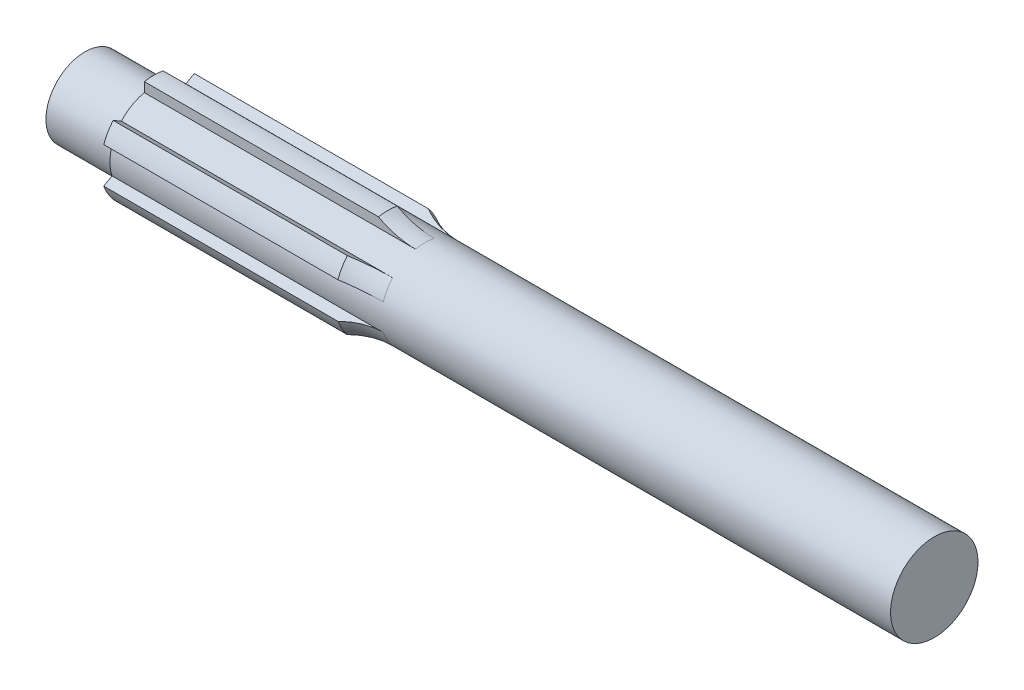
from build123d import *

# Parameters (mm, degrees)
SKETCH1_R           = 12.5
BOSS_EXTRUDE1_DEPTH = 22
SKETCH3_R           = 14
BOSS_EXTRUDE2_DEPTH = 250
BOSS_EXTRUDE3_DEPTH = 75
FILLET3_R           = 25


with BuildPart() as part:
    # Sketch1 → Boss-Extrude1 (new body)
    with BuildSketch(Plane(origin=(0, 0, 0), x_dir=(0, 0, -1), z_dir=(1, 0, 0))):
        Circle(SKETCH1_R)
    extrude(amount=BOSS_EXTRUDE1_DEPTH)

    # Sketch3 → Boss-Extrude2 (add)
    with BuildSketch(Plane(origin=(22, 0, 0), x_dir=(0, 0, -1), z_dir=(1, 0, 0))):
        Circle(SKETCH3_R)
    extrude(amount=BOSS_EXTRUDE2_DEPTH)

    # Sketch2 → Boss-Extrude3 (add)
    with BuildSketch(Plane(origin=(22, 0, 0), x_dir=(0, 0, -1), z_dir=(1, 0, 0))):
        with BuildLine():
            Line((-13.342719282, -4.239320954), (-15.991376746, -5.768524054))
            ThreePointArc((-15.991376746, -5.768524054), (-14.722431864, -8.5), (-12.991376746, -10.964676477))
            Line((-12.991376746, -10.964676477), (-10.342719282, -9.435473377))
            ThreePointArc((-10.342719282, -9.435473377), (-7, -12.124355653), (-3, -13.674794331))
            Line((-3, -13.674794331), (-3, -16.733200531))
            ThreePointArc((-3, -16.733200531), (0, -17), (3, -16.733200531))
            Line((3, -16.733200531), (3, -13.674794331))
            ThreePointArc((3, -13.674794331), (7, -12.124355653), (10.342719282, -9.435473377))
            Line((10.342719282, -9.435473377), (12.991376746, -10.964676477))
            ThreePointArc((12.991376746, -10.964676477), (14.722431864, -8.5), (15.991376746, -5.768524054))
            Line((15.991376746, -5.768524054), (13.342719282, -4.239320954))
            ThreePointArc((13.342719282, -4.239320954), (14, 0), (13.342719282, 4.239320954))
            Line((13.342719282, 4.239320954), (15.991376746, 5.768524054))
            ThreePointArc((15.991376746, 5.768524054), (14.722431864, 8.5), (12.991376746, 10.964676477))
            Line((12.991376746, 10.964676477), (10.342719282, 9.435473377))
            ThreePointArc((10.342719282, 9.435473377), (7, 12.124355653), (3, 13.674794331))
            Line((3, 13.674794331), (3, 16.733200531))
            ThreePointArc((3, 16.733200531), (0, 17), (-3, 16.733200531))
            Line((-3, 16.733200531), (-3, 13.674794331))
            ThreePointArc((-3, 13.674794331), (-7, 12.124355653), (-10.342719282, 9.435473377))
            Line((-10.342719282, 9.435473377), (-12.991376746, 10.964676477))
            ThreePointArc((-12.991376746, 10.964676477), (-14.722431864, 8.5), (-15.991376746, 5.768524054))
            Line((-15.991376746, 5.768524054), (-13.342719282, 4.239320954))
            ThreePointArc((-13.342719282, 4.239320954), (-14, 0), (-13.342719282, -4.239320954))
        make_face()
    extrude(amount=BOSS_EXTRUDE3_DEPTH)

    # Fillet3
    # the kernel refuses this fillet: 25 mm, written as the material it adds along each edge
    with BuildSketch(Plane(origin=(97, 0, 0), x_dir=(0, 0.27784568580579977, 0.960625720496336), z_dir=(0, -0.960625720496336, 0.27784568580579977))) as fillet3_piece_1_section:
        with BuildLine():
            CenterArc((39, -11.874342087), FILLET3_R, 151.642363424, 28.357636576)
            Line((17, 0), (14, 0))
            Line((14, 0), (14, -11.874342087))
        make_face()
    fillet3_piece_1 = revolve(axis=Axis((97, 0, 0), (-1, 0, 0)), revolution_arc=267.736659013, mode=Mode.PRIVATE)
    fillet3_piece_1 = split(fillet3_piece_1, bisect_by=Plane(origin=(97, 2.598076211, -1.5), z_dir=(0, -0.8660254037844357, 0.5000000000000051)), keep=Keep.TOP, mode=Mode.PRIVATE)
    fillet3_piece_1 = split(fillet3_piece_1, bisect_by=Plane(origin=(97, -2.598076211, 1.5), z_dir=(0, 0.8660254037844359, -0.5000000000000047)), keep=Keep.TOP, mode=Mode.PRIVATE)
    add(fillet3_piece_1)
    with BuildSketch(Plane(origin=(97, 0, 0), x_dir=(0, 0.27784568580579977, 0.960625720496336), z_dir=(0, -0.960625720496336, 0.27784568580579977))) as fillet3_piece_2_section:
        with BuildLine():
            CenterArc((39, -11.874342087), FILLET3_R, 151.642363424, 28.357636576)
            Line((17, 0), (14, 0))
            Line((14, 0), (14, -11.874342087))
        make_face()
    fillet3_piece_2 = revolve(axis=Axis((97, 0, 0), (-1, 0, 0)), revolution_arc=267.736659013, mode=Mode.PRIVATE)
    fillet3_piece_2 = split(fillet3_piece_2, bisect_by=Plane(origin=(97, 0, -3), z_dir=(0, 0, 1)), keep=Keep.TOP, mode=Mode.PRIVATE)
    fillet3_piece_2 = split(fillet3_piece_2, bisect_by=Plane(origin=(97, 0, 3), z_dir=(0, 0, -1)), keep=Keep.TOP, mode=Mode.PRIVATE)
    add(fillet3_piece_2)
    with BuildSketch(Plane(origin=(97, 0, 0), x_dir=(0, 0.27784568580579977, 0.960625720496336), z_dir=(0, -0.960625720496336, 0.27784568580579977))) as fillet3_piece_3_section:
        with BuildLine():
            CenterArc((39, -11.874342087), FILLET3_R, 151.642363424, 28.357636576)
            Line((17, 0), (14, 0))
            Line((14, 0), (14, -11.874342087))
        make_face()
    fillet3_piece_3 = revolve(axis=Axis((97, 0, 0), (-1, 0, 0)), revolution_arc=267.736659013, mode=Mode.PRIVATE)
    fillet3_piece_3 = split(fillet3_piece_3, bisect_by=Plane(origin=(97, -2.598076211, -1.5), z_dir=(0, 0.8660254037844438, 0.4999999999999911)), keep=Keep.TOP, mode=Mode.PRIVATE)
    fillet3_piece_3 = split(fillet3_piece_3, bisect_by=Plane(origin=(97, 2.598076211, 1.5), z_dir=(0, -0.8660254037844435, -0.49999999999999156)), keep=Keep.TOP, mode=Mode.PRIVATE)
    add(fillet3_piece_3)
    with BuildSketch(Plane(origin=(97, 0, 0), x_dir=(0, 0.9708491203814568, 0.23969143800843562), z_dir=(0, -0.23969143800843562, 0.9708491203814568))) as fillet3_piece_4_section:
        with BuildLine():
            CenterArc((39, -11.874342087), FILLET3_R, 151.642363424, 28.357636576)
            Line((17, 0), (14, 0))
            Line((14, 0), (14, -11.874342087))
        make_face()
    fillet3_piece_4 = revolve(axis=Axis((97, 0, 0), (-1, 0, 0)), revolution_arc=267.736659013, mode=Mode.PRIVATE)
    fillet3_piece_4 = split(fillet3_piece_4, bisect_by=Plane(origin=(97, 0, -3), z_dir=(0, 0, 1)), keep=Keep.TOP, mode=Mode.PRIVATE)
    fillet3_piece_4 = split(fillet3_piece_4, bisect_by=Plane(origin=(97, 0, 3), z_dir=(0, 0, -1)), keep=Keep.TOP, mode=Mode.PRIVATE)
    add(fillet3_piece_4)
    with BuildSketch(Plane(origin=(97, 0, 0), x_dir=(0, 0.9708491203814568, 0.23969143800843562), z_dir=(0, -0.23969143800843562, 0.9708491203814568))) as fillet3_piece_5_section:
        with BuildLine():
            CenterArc((39, -11.874342087), FILLET3_R, 151.642363424, 28.357636576)
            Line((17, 0), (14, 0))
            Line((14, 0), (14, -11.874342087))
        make_face()
    fillet3_piece_5 = revolve(axis=Axis((97, 0, 0), (-1, 0, 0)), revolution_arc=267.736659013, mode=Mode.PRIVATE)
    fillet3_piece_5 = split(fillet3_piece_5, bisect_by=Plane(origin=(97, -2.598076211, -1.5), z_dir=(0, 0.8660254037844438, 0.4999999999999911)), keep=Keep.TOP, mode=Mode.PRIVATE)
    fillet3_piece_5 = split(fillet3_piece_5, bisect_by=Plane(origin=(97, 2.598076211, 1.5), z_dir=(0, -0.8660254037844435, -0.49999999999999156)), keep=Keep.TOP, mode=Mode.PRIVATE)
    add(fillet3_piece_5)
    with BuildSketch(Plane(origin=(97, 0, 0), x_dir=(0, 0.9708491203814568, 0.23969143800843562), z_dir=(0, -0.23969143800843562, 0.9708491203814568))) as fillet3_piece_6_section:
        with BuildLine():
            CenterArc((39, -11.874342087), FILLET3_R, 151.642363424, 28.357636576)
            Line((17, 0), (14, 0))
            Line((14, 0), (14, -11.874342087))
        make_face()
    fillet3_piece_6 = revolve(axis=Axis((97, 0, 0), (-1, 0, 0)), revolution_arc=267.736659013, mode=Mode.PRIVATE)
    fillet3_piece_6 = split(fillet3_piece_6, bisect_by=Plane(origin=(97, -2.598076211, 1.5), z_dir=(0, 0.8660254037844325, -0.5000000000000107)), keep=Keep.TOP, mode=Mode.PRIVATE)
    fillet3_piece_6 = split(fillet3_piece_6, bisect_by=Plane(origin=(97, 2.598076211, -1.5), z_dir=(0, -0.8660254037844329, 0.5000000000000101)), keep=Keep.TOP, mode=Mode.PRIVATE)
    add(fillet3_piece_6)
    with BuildSketch(Plane(origin=(97, 0, 0), x_dir=(0, 0.6930034345756666, -0.7209342824878907), z_dir=(0, 0.7209342824878907, 0.6930034345756666))) as fillet3_piece_7_section:
        with BuildLine():
            CenterArc((39, -11.874342087), FILLET3_R, 151.642363424, 28.357636576)
            Line((17, 0), (14, 0))
            Line((14, 0), (14, -11.874342087))
        make_face()
    fillet3_piece_7 = revolve(axis=Axis((97, 0, 0), (-1, 0, 0)), revolution_arc=267.736659013, mode=Mode.PRIVATE)
    fillet3_piece_7 = split(fillet3_piece_7, bisect_by=Plane(origin=(97, -2.598076211, -1.5), z_dir=(0, 0.8660254037844438, 0.4999999999999911)), keep=Keep.TOP, mode=Mode.PRIVATE)
    fillet3_piece_7 = split(fillet3_piece_7, bisect_by=Plane(origin=(97, 2.598076211, 1.5), z_dir=(0, -0.8660254037844435, -0.49999999999999156)), keep=Keep.TOP, mode=Mode.PRIVATE)
    add(fillet3_piece_7)
    with BuildSketch(Plane(origin=(97, 0, 0), x_dir=(0, 0.6930034345756666, -0.7209342824878907), z_dir=(0, 0.7209342824878907, 0.6930034345756666))) as fillet3_piece_8_section:
        with BuildLine():
            CenterArc((39, -11.874342087), FILLET3_R, 151.642363424, 28.357636576)
            Line((17, 0), (14, 0))
            Line((14, 0), (14, -11.874342087))
        make_face()
    fillet3_piece_8 = revolve(axis=Axis((97, 0, 0), (-1, 0, 0)), revolution_arc=267.736659013, mode=Mode.PRIVATE)
    fillet3_piece_8 = split(fillet3_piece_8, bisect_by=Plane(origin=(97, 2.598076211, -1.5), z_dir=(0, -0.8660254037844357, 0.5000000000000051)), keep=Keep.TOP, mode=Mode.PRIVATE)
    fillet3_piece_8 = split(fillet3_piece_8, bisect_by=Plane(origin=(97, -2.598076211, 1.5), z_dir=(0, 0.8660254037844359, -0.5000000000000047)), keep=Keep.TOP, mode=Mode.PRIVATE)
    add(fillet3_piece_8)
    with BuildSketch(Plane(origin=(97, 0, 0), x_dir=(0, 0.6930034345756666, -0.7209342824878907), z_dir=(0, 0.7209342824878907, 0.6930034345756666))) as fillet3_piece_9_section:
        with BuildLine():
            CenterArc((39, -11.874342087), FILLET3_R, 151.642363424, 28.357636576)
            Line((17, 0), (14, 0))
            Line((14, 0), (14, -11.874342087))
        make_face()
    fillet3_piece_9 = revolve(axis=Axis((97, 0, 0), (-1, 0, 0)), revolution_arc=267.736659013, mode=Mode.PRIVATE)
    fillet3_piece_9 = split(fillet3_piece_9, bisect_by=Plane(origin=(97, 0, 3), z_dir=(0, 0, -1)), keep=Keep.TOP, mode=Mode.PRIVATE)
    fillet3_piece_9 = split(fillet3_piece_9, bisect_by=Plane(origin=(97, 0, -3), z_dir=(0, 0, 1)), keep=Keep.TOP, mode=Mode.PRIVATE)
    add(fillet3_piece_9)
    with BuildSketch(Plane(origin=(97, 0, 0), x_dir=(0, -0.2778456858057889, -0.9606257204963392), z_dir=(0, 0.9606257204963392, -0.2778456858057889))) as fillet3_piece_10_section:
        with BuildLine():
            CenterArc((39, -11.874342087), FILLET3_R, 151.642363424, 28.357636576)
            Line((17, 0), (14, 0))
            Line((14, 0), (14, -11.874342087))
        make_face()
    fillet3_piece_10 = revolve(axis=Axis((97, 0, 0), (-1, 0, 0)), revolution_arc=267.736659013, mode=Mode.PRIVATE)
    fillet3_piece_10 = split(fillet3_piece_10, bisect_by=Plane(origin=(97, 2.598076211, -1.5), z_dir=(0, -0.8660254037844357, 0.5000000000000051)), keep=Keep.TOP, mode=Mode.PRIVATE)
    fillet3_piece_10 = split(fillet3_piece_10, bisect_by=Plane(origin=(97, -2.598076211, 1.5), z_dir=(0, 0.8660254037844359, -0.5000000000000047)), keep=Keep.TOP, mode=Mode.PRIVATE)
    add(fillet3_piece_10)
    with BuildSketch(Plane(origin=(97, 0, 0), x_dir=(0, -0.2778456858057889, -0.9606257204963392), z_dir=(0, 0.9606257204963392, -0.2778456858057889))) as fillet3_piece_11_section:
        with BuildLine():
            CenterArc((39, -11.874342087), FILLET3_R, 151.642363424, 28.357636576)
            Line((17, 0), (14, 0))
            Line((14, 0), (14, -11.874342087))
        make_face()
    fillet3_piece_11 = revolve(axis=Axis((97, 0, 0), (-1, 0, 0)), revolution_arc=267.736659013, mode=Mode.PRIVATE)
    fillet3_piece_11 = split(fillet3_piece_11, bisect_by=Plane(origin=(97, 0, -3), z_dir=(0, 0, 1)), keep=Keep.TOP, mode=Mode.PRIVATE)
    fillet3_piece_11 = split(fillet3_piece_11, bisect_by=Plane(origin=(97, 0, 3), z_dir=(0, 0, -1)), keep=Keep.TOP, mode=Mode.PRIVATE)
    add(fillet3_piece_11)
    with BuildSketch(Plane(origin=(97, 0, 0), x_dir=(0, -0.2778456858057889, -0.9606257204963392), z_dir=(0, 0.9606257204963392, -0.2778456858057889))) as fillet3_piece_12_section:
        with BuildLine():
            CenterArc((39, -11.874342087), FILLET3_R, 151.642363424, 28.357636576)
            Line((17, 0), (14, 0))
            Line((14, 0), (14, -11.874342087))
        make_face()
    fillet3_piece_12 = revolve(axis=Axis((97, 0, 0), (-1, 0, 0)), revolution_arc=267.736659013, mode=Mode.PRIVATE)
    fillet3_piece_12 = split(fillet3_piece_12, bisect_by=Plane(origin=(97, 2.598076211, 1.5), z_dir=(0, -0.86602540378444, -0.4999999999999976)), keep=Keep.TOP, mode=Mode.PRIVATE)
    fillet3_piece_12 = split(fillet3_piece_12, bisect_by=Plane(origin=(97, -2.598076211, -1.5), z_dir=(0, 0.86602540378444, 0.49999999999999767)), keep=Keep.TOP, mode=Mode.PRIVATE)
    add(fillet3_piece_12)
    with BuildSketch(Plane(origin=(97, 0, 0), x_dir=(0, -0.9708491203814544, -0.23969143800844478), z_dir=(0, 0.23969143800844478, -0.9708491203814544))) as fillet3_piece_13_section:
        with BuildLine():
            CenterArc((39, -11.874342087), FILLET3_R, 151.642363424, 28.357636576)
            Line((17, 0), (14, 0))
            Line((14, 0), (14, -11.874342087))
        make_face()
    fillet3_piece_13 = revolve(axis=Axis((97, 0, 0), (-1, 0, 0)), revolution_arc=267.736659013, mode=Mode.PRIVATE)
    fillet3_piece_13 = split(fillet3_piece_13, bisect_by=Plane(origin=(97, 0, -3), z_dir=(0, 0, 1)), keep=Keep.TOP, mode=Mode.PRIVATE)
    fillet3_piece_13 = split(fillet3_piece_13, bisect_by=Plane(origin=(97, 0, 3), z_dir=(0, 0, -1)), keep=Keep.TOP, mode=Mode.PRIVATE)
    add(fillet3_piece_13)
    with BuildSketch(Plane(origin=(97, 0, 0), x_dir=(0, -0.9708491203814544, -0.23969143800844478), z_dir=(0, 0.23969143800844478, -0.9708491203814544))) as fillet3_piece_14_section:
        with BuildLine():
            CenterArc((39, -11.874342087), FILLET3_R, 151.642363424, 28.357636576)
            Line((17, 0), (14, 0))
            Line((14, 0), (14, -11.874342087))
        make_face()
    fillet3_piece_14 = revolve(axis=Axis((97, 0, 0), (-1, 0, 0)), revolution_arc=267.736659013, mode=Mode.PRIVATE)
    fillet3_piece_14 = split(fillet3_piece_14, bisect_by=Plane(origin=(97, -2.598076211, -1.5), z_dir=(0, 0.8660254037844438, 0.4999999999999911)), keep=Keep.TOP, mode=Mode.PRIVATE)
    fillet3_piece_14 = split(fillet3_piece_14, bisect_by=Plane(origin=(97, 2.598076211, 1.5), z_dir=(0, -0.8660254037844435, -0.49999999999999156)), keep=Keep.TOP, mode=Mode.PRIVATE)
    add(fillet3_piece_14)
    with BuildSketch(Plane(origin=(97, 0, 0), x_dir=(0, -0.9708491203814544, -0.23969143800844478), z_dir=(0, 0.23969143800844478, -0.9708491203814544))) as fillet3_piece_15_section:
        with BuildLine():
            CenterArc((39, -11.874342087), FILLET3_R, 151.642363424, 28.357636576)
            Line((17, 0), (14, 0))
            Line((14, 0), (14, -11.874342087))
        make_face()
    fillet3_piece_15 = revolve(axis=Axis((97, 0, 0), (-1, 0, 0)), revolution_arc=267.736659013, mode=Mode.PRIVATE)
    fillet3_piece_15 = split(fillet3_piece_15, bisect_by=Plane(origin=(97, 2.598076211, -1.5), z_dir=(0, -0.8660254037844357, 0.5000000000000051)), keep=Keep.TOP, mode=Mode.PRIVATE)
    fillet3_piece_15 = split(fillet3_piece_15, bisect_by=Plane(origin=(97, -2.598076211, 1.5), z_dir=(0, 0.8660254037844359, -0.5000000000000047)), keep=Keep.TOP, mode=Mode.PRIVATE)
    add(fillet3_piece_15)
    with BuildSketch(Plane(origin=(97, 0, 0), x_dir=(0, -0.6930034345756619, 0.7209342824878952), z_dir=(0, -0.7209342824878952, -0.6930034345756619))) as fillet3_piece_16_section:
        with BuildLine():
            CenterArc((39, -11.874342087), FILLET3_R, 151.642363424, 28.357636576)
            Line((17, 0), (14, 0))
            Line((14, 0), (14, -11.874342087))
        make_face()
    fillet3_piece_16 = revolve(axis=Axis((97, 0, 0), (-1, 0, 0)), revolution_arc=267.736659013, mode=Mode.PRIVATE)
    fillet3_piece_16 = split(fillet3_piece_16, bisect_by=Plane(origin=(97, -2.598076211, -1.5), z_dir=(0, 0.8660254037844438, 0.4999999999999911)), keep=Keep.TOP, mode=Mode.PRIVATE)
    fillet3_piece_16 = split(fillet3_piece_16, bisect_by=Plane(origin=(97, 2.598076211, 1.5), z_dir=(0, -0.8660254037844435, -0.49999999999999156)), keep=Keep.TOP, mode=Mode.PRIVATE)
    add(fillet3_piece_16)
    with BuildSketch(Plane(origin=(97, 0, 0), x_dir=(0, -0.6930034345756619, 0.7209342824878952), z_dir=(0, -0.7209342824878952, -0.6930034345756619))) as fillet3_piece_17_section:
        with BuildLine():
            CenterArc((39, -11.874342087), FILLET3_R, 151.642363424, 28.357636576)
            Line((17, 0), (14, 0))
            Line((14, 0), (14, -11.874342087))
        make_face()
    fillet3_piece_17 = revolve(axis=Axis((97, 0, 0), (-1, 0, 0)), revolution_arc=267.736659013, mode=Mode.PRIVATE)
    fillet3_piece_17 = split(fillet3_piece_17, bisect_by=Plane(origin=(97, 2.598076211, -1.5), z_dir=(0, -0.8660254037844357, 0.5000000000000051)), keep=Keep.TOP, mode=Mode.PRIVATE)
    fillet3_piece_17 = split(fillet3_piece_17, bisect_by=Plane(origin=(97, -2.598076211, 1.5), z_dir=(0, 0.8660254037844359, -0.5000000000000047)), keep=Keep.TOP, mode=Mode.PRIVATE)
    add(fillet3_piece_17)
    with BuildSketch(Plane(origin=(97, 0, 0), x_dir=(0, -0.6930034345756619, 0.7209342824878952), z_dir=(0, -0.7209342824878952, -0.6930034345756619))) as fillet3_piece_18_section:
        with BuildLine():
            CenterArc((39, -11.874342087), FILLET3_R, 151.642363424, 28.357636576)
            Line((17, 0), (14, 0))
            Line((14, 0), (14, -11.874342087))
        make_face()
    fillet3_piece_18 = revolve(axis=Axis((97, 0, 0), (-1, 0, 0)), revolution_arc=267.736659013, mode=Mode.PRIVATE)
    fillet3_piece_18 = split(fillet3_piece_18, bisect_by=Plane(origin=(97, 0, -3), z_dir=(0, 0, 1)), keep=Keep.TOP, mode=Mode.PRIVATE)
    fillet3_piece_18 = split(fillet3_piece_18, bisect_by=Plane(origin=(97, 0, 3), z_dir=(0, 0, -1)), keep=Keep.TOP, mode=Mode.PRIVATE)
    add(fillet3_piece_18)


solid = part.part
